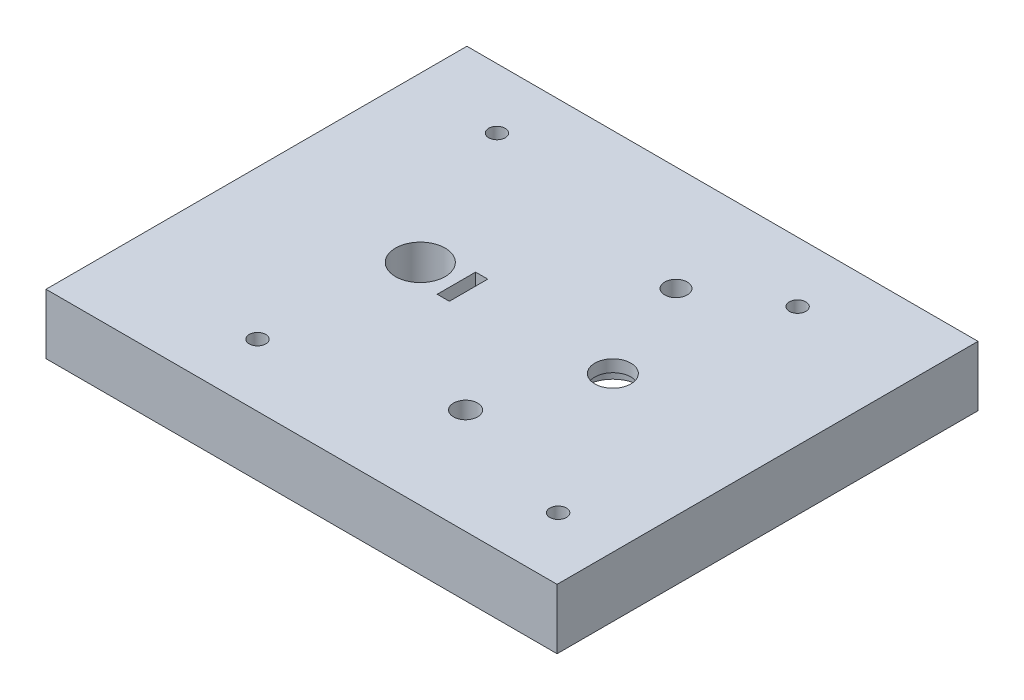
from build123d import *

# Parameters (mm, degrees)
SKETCH1_W           = 85
SKETCH1_H           = 70
SKETCH1_R           = 1.375
SKETCH1_R_2         = 4.125
SKETCH1_W_2         = 2.024682369
SKETCH1_H_2         = 6.385975888
SKETCH1_R_3         = 1.875
SKETCH1_R_4         = 2
SKETCH1_R_5         = 3
BOSS_EXTRUDE4_DEPTH = 10
SKETCH1_7_R         = 2
SKETCH1_7_R_2       = 4.5
SKETCH1_7_R_3       = 1.875
CUT_EXTRUDE2_DEPTH  = 6
SKETCH1_11_R        = 4.5
SKETCH1_11_R_2      = 3
CUT_EXTRUDE10_DEPTH = 8


with BuildPart() as part:
    # Sketch1 → Boss-Extrude4 (new body)
    with BuildSketch(Plane(origin=(0, 0, 0), x_dir=(1, 0, 0), z_dir=(0, 1, 0))):
        with Locations((-9.775924906, 0)):
            Rectangle(SKETCH1_W, SKETCH1_H)
        with Locations((-27.5, -24.60667729)):
            Circle(SKETCH1_R, mode=Mode.SUBTRACT)
        with Locations((22.5, -24.60667729)):
            Circle(SKETCH1_R, mode=Mode.SUBTRACT)
        with Locations((-25.024682369, 0)):
            Circle(SKETCH1_R_2, mode=Mode.SUBTRACT)
        with Locations((-18.012341185, 0)):
            Rectangle(SKETCH1_W_2, SKETCH1_H_2, mode=Mode.SUBTRACT)
        with Locations((-37.275924906, 25)):
            Circle(SKETCH1_R, mode=Mode.SUBTRACT)
        with Locations((12.724075094, 25)):
            Circle(SKETCH1_R, mode=Mode.SUBTRACT)
        with Locations((0, 17.5)):
            Circle(SKETCH1_R_3, mode=Mode.SUBTRACT)
        with Locations((0, -17.5)):
            Circle(SKETCH1_R_4, mode=Mode.SUBTRACT)
        with Locations((7, 0)):
            Circle(SKETCH1_R_5, mode=Mode.SUBTRACT)
    extrude(amount=BOSS_EXTRUDE4_DEPTH)

    # Sketch1<7> → Cut-Extrude2 (cut)
    with BuildSketch(Plane(origin=(0, 0, 0), x_dir=(1, 0, 0), z_dir=(0, 1, 0))):
        with BuildLine():
            Line((3.625, 13.729507457), (3.625, 17.5))
            ThreePointArc((3.625, 17.5), (0, 21.125), (-3.625, 17.5))
            Line((-3.625, 17.5), (-3.625, 13.729507457))
            ThreePointArc((-3.625, 13.729507457), (-8.669470541, 11.246345208), (-12.354756169, 7))
            Line((-12.354756169, 7), (-17, 7))
            Line((-17, 7), (-17, 3.192987944))
            Line((-17, 3.192987944), (-19.024682369, 3.192987944))
            Line((-19.024682369, 3.192987944), (-19.024682369, -3.192987944))
            Line((-19.024682369, -3.192987944), (-17, -3.192987944))
            Line((-17, -3.192987944), (-17, -7))
            Line((-17, -7), (-12.354756169, -7))
            ThreePointArc((-12.354756169, -7), (-8.669470541, -11.246345208), (-3.625, -13.729507457))
            Line((-3.625, -13.729507457), (-3.625, -17.5))
            ThreePointArc((-3.625, -17.5), (0, -21.125), (3.625, -17.5))
            Line((3.625, -17.5), (3.625, -13.729507457))
            ThreePointArc((3.625, -13.729507457), (14.2, 0), (3.625, 13.729507457))
        make_face()
        with Locations((0, -17.5)):
            Circle(SKETCH1_7_R, mode=Mode.SUBTRACT)
        with Locations((7, 0)):
            Circle(SKETCH1_7_R_2, mode=Mode.SUBTRACT)
        with Locations((0, 17.5)):
            Circle(SKETCH1_7_R_3, mode=Mode.SUBTRACT)
    extrude(amount=CUT_EXTRUDE2_DEPTH, mode=Mode.SUBTRACT)

    # Sketch1<11> → Cut-Extrude10 (cut)
    with BuildSketch(Plane(origin=(0, 0, 0), x_dir=(1, 0, 0), z_dir=(0, 1, 0))):
        with Locations((7, 0)):
            Circle(SKETCH1_11_R)
        with Locations((7, 0)):
            Circle(SKETCH1_11_R_2, mode=Mode.SUBTRACT)
    extrude(amount=CUT_EXTRUDE10_DEPTH, mode=Mode.SUBTRACT)


solid = part.part
